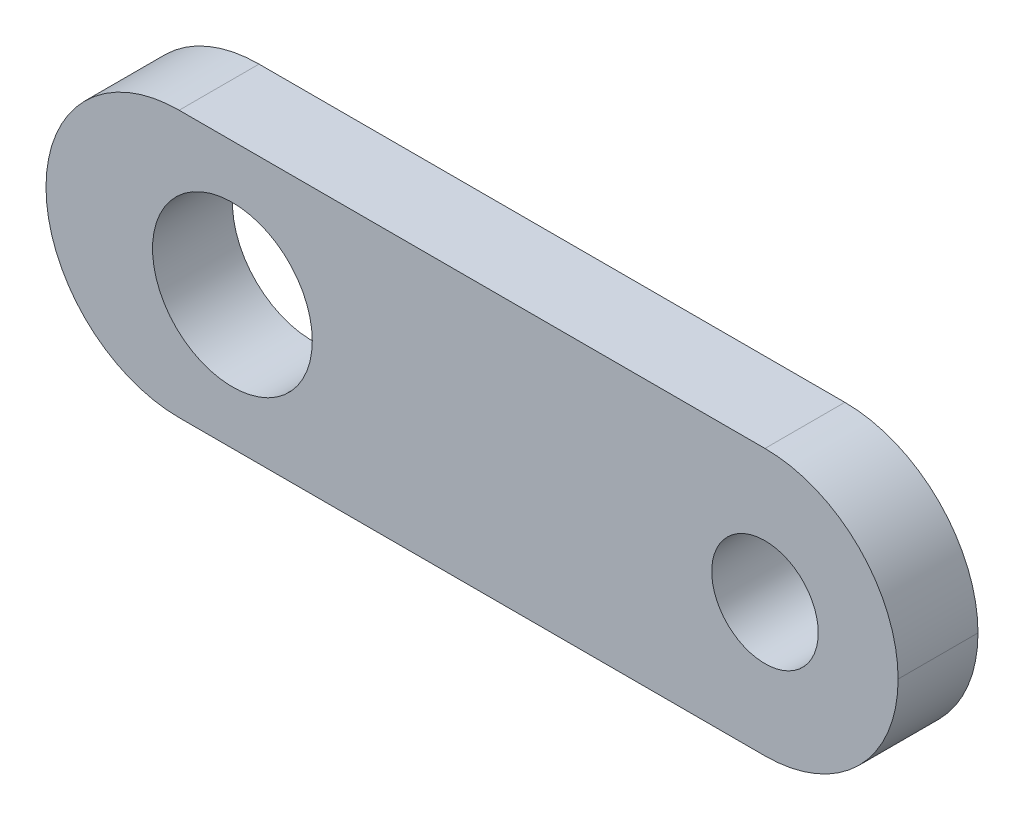
from build123d import *

# Parameters (mm, degrees)
SKETCH_1_W      = 32
SKETCH_1_H      = 10
SKETCH_1_R      = 3
SKETCH_1_R_2    = 2
EXTRUDE_1_DEPTH = 3
FILLET_1_R      = 5


with BuildPart() as part:
    # 草图1 → 凸台-拉伸1 (new body)
    with BuildSketch(Plane.XY):
        with Locations((9, 0)):
            Rectangle(SKETCH_1_W, SKETCH_1_H)
        Circle(SKETCH_1_R, mode=Mode.SUBTRACT)
        with Locations((20, 0)):
            Circle(SKETCH_1_R_2, mode=Mode.SUBTRACT)
    extrude(amount=EXTRUDE_1_DEPTH)

    # 圆角1
    fillet_1_edges = [part.edges().sort_by_distance(p)[0] for p in [
        (25, -5, 1.5),
        (25, 5, 1.5),
        (-7, -5, 1.5),
        (-7, 5, 1.5),
    ]]
    fillet(fillet_1_edges, radius=FILLET_1_R - 0.0001)  # a hair under: the kernel refuses the full size


solid = part.part
